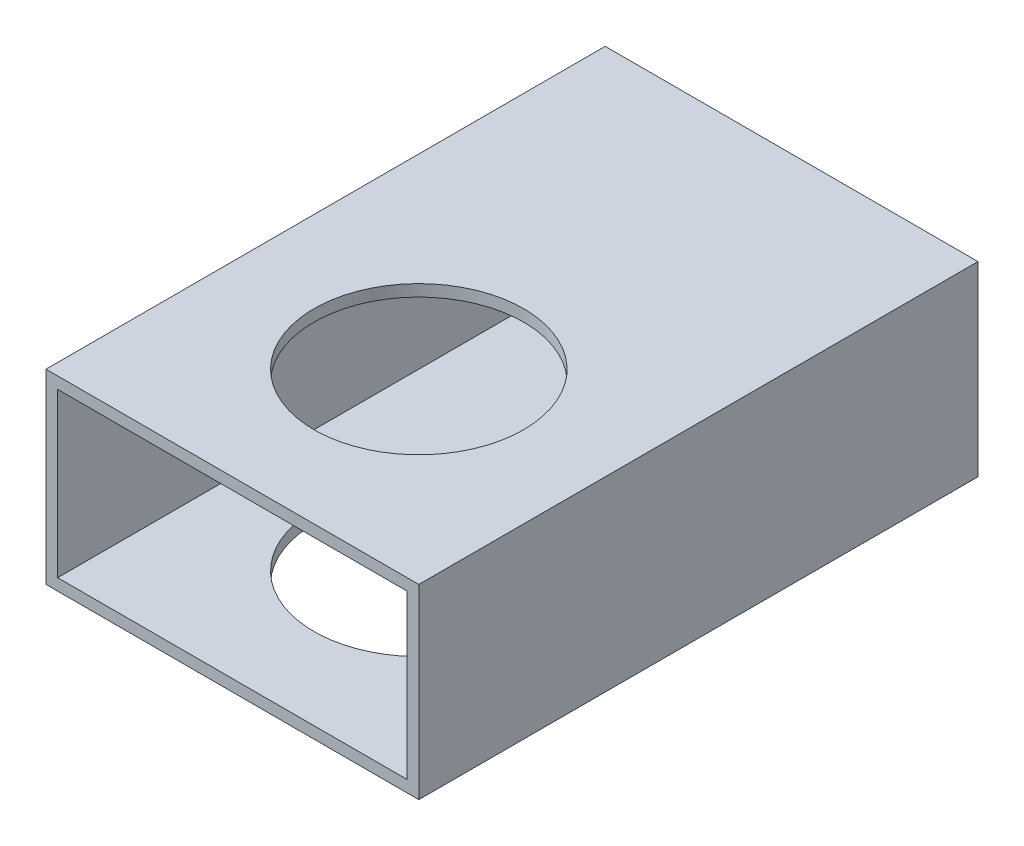
from build123d import *

# Parameters (mm, degrees)
SKETCH1_W           = 50.8
SKETCH1_H           = 25.4
SKETCH1_W_2         = 47.625
SKETCH1_H_2         = 22.225
BOSS_EXTRUDE1_DEPTH = 76.2
SKETCH2_R           = 14.2875
CUT_EXTRUDE1_DEPTH  = 85.242269675


with BuildPart() as part:
    # Sketch1 → Boss-Extrude1 (new body)
    with BuildSketch(Plane.XY):
        Rectangle(SKETCH1_W, SKETCH1_H)
        Rectangle(SKETCH1_W_2, SKETCH1_H_2, mode=Mode.SUBTRACT)
    extrude(amount=BOSS_EXTRUDE1_DEPTH)

    # Sketch2 → Cut-Extrude1 (cut, through all)
    with BuildSketch(Plane.XZ.offset(12.7)):
        with Locations((0, 50.8)):
            Circle(SKETCH2_R)
    extrude(amount=-CUT_EXTRUDE1_DEPTH, mode=Mode.SUBTRACT)


solid = part.part
